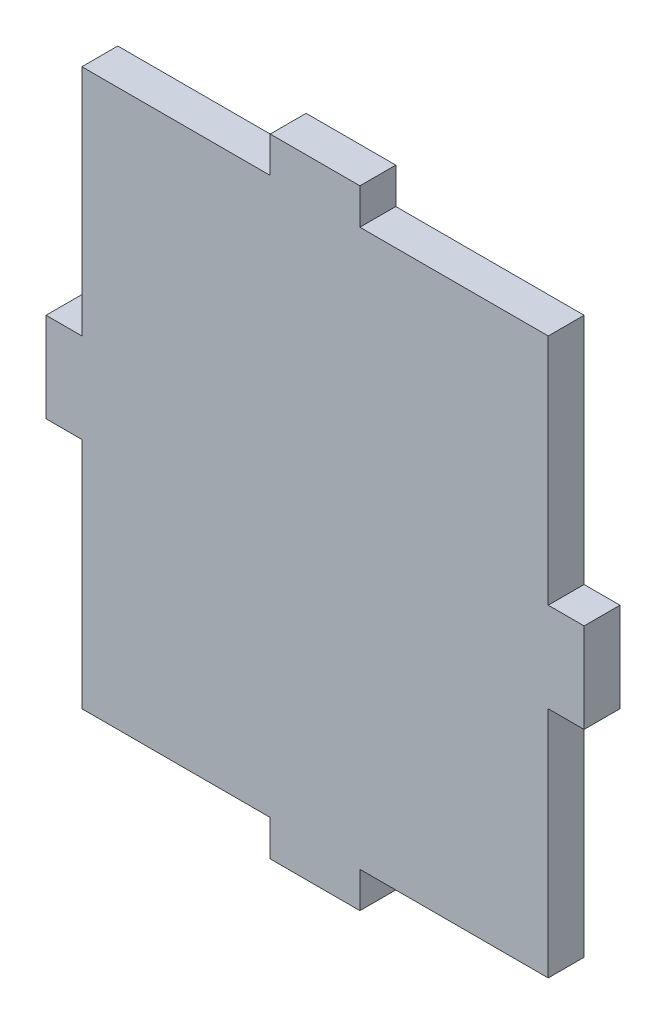
from build123d import *

# Parameters (mm, degrees)
SKETCH1_W           = 52
SKETCH1_H           = 62
BOSS_EXTRUDE1_DEPTH = 4
SKETCH2_W           = 4
SKETCH2_H           = 10
SKETCH2_W_2         = 10
SKETCH2_H_2         = 4
BOSS_EXTRUDE2_DEPTH = 4


with BuildPart() as part:
    # Sketch1 → Boss-Extrude1 (new body)
    with BuildSketch(Plane.XY):
        with Locations((26, 31)):
            Rectangle(SKETCH1_W, SKETCH1_H)
    extrude(amount=BOSS_EXTRUDE1_DEPTH)

    # Sketch2 → Boss-Extrude2 (add)
    with BuildSketch(Plane.XY.offset(4)):
        with Locations((-2, 31)):
            Rectangle(SKETCH2_W, SKETCH2_H)
        with Locations((54, 31)):
            Rectangle(SKETCH2_W, SKETCH2_H)
        with Locations((26, -2)):
            Rectangle(SKETCH2_W_2, SKETCH2_H_2)
        with Locations((26, 64)):
            Rectangle(SKETCH2_W_2, SKETCH2_H_2)
    extrude(amount=-BOSS_EXTRUDE2_DEPTH)


solid = part.part
